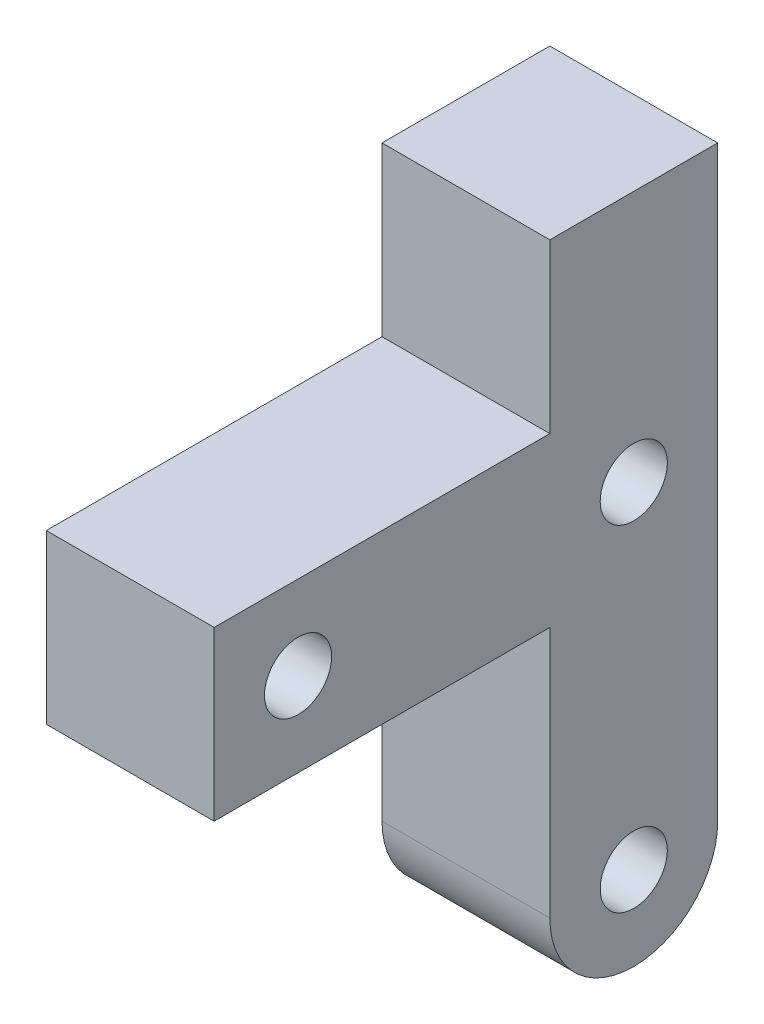
from build123d import *

# Parameters (mm, degrees)
SKETCH1_W           = 10
SKETCH1_H           = 40
BOSS_EXTRUDE1_DEPTH = 10
CUT_EXTRUDE1_REACH  = 44.426
SKETCH2_R           = 2
SKETCH3_W           = 10
SKETCH3_H           = 10
BOSS_EXTRUDE2_DEPTH = 20
CUT_EXTRUDE2_REACH  = 52.99
SKETCH4_R           = 2
SKETCH5_R           = 2
CUT_EXTRUDE3_DEPTH  = 51.990195136
FILLET1_R           = 5


with BuildPart() as part:
    # Sketch1 → Boss-Extrude1 (new body)
    with BuildSketch(Plane.XY):
        with Locations((5, 20)):
            Rectangle(SKETCH1_W, SKETCH1_H)
    extrude(amount=BOSS_EXTRUDE1_DEPTH)

    # Sketch2 → Cut-Extrude1 (cut, up to next)
    with BuildSketch(Plane(origin=(10, 0, 0), x_dir=(0, 0, -1), z_dir=(1, 0, 0)), mode=Mode.PRIVATE) as cut_extrude1_sk1:
        with Locations((-5, 5)):
            Circle(SKETCH2_R)
    cut_extrude1_tool1 = extrude(cut_extrude1_sk1.sketch, amount=-CUT_EXTRUDE1_REACH, mode=Mode.PRIVATE) & part.part
    add(cut_extrude1_tool1.solids().sort_by_distance((10, 5, 5))[0], mode=Mode.SUBTRACT)

    # Sketch3 → Boss-Extrude2 (add)
    with BuildSketch(Plane.XY.offset(10)):
        with Locations((5, 25)):
            Rectangle(SKETCH3_W, SKETCH3_H)
    extrude(amount=BOSS_EXTRUDE2_DEPTH)

    # Sketch4 → Cut-Extrude2 (cut, up to next)
    with BuildSketch(Plane.ZY, mode=Mode.PRIVATE) as cut_extrude2_sk1:
        with Locations((25, 25)):
            Circle(SKETCH4_R)
    cut_extrude2_tool1 = extrude(cut_extrude2_sk1.sketch, amount=-CUT_EXTRUDE2_REACH, mode=Mode.PRIVATE) & part.part
    add(cut_extrude2_tool1.solids().sort_by_distance((0, 25, 25))[0], mode=Mode.SUBTRACT)

    # Sketch5 → Cut-Extrude3 (cut, through all)
    with BuildSketch(Plane.ZY):
        with Locations((5, 25)):
            Circle(SKETCH5_R)
    extrude(amount=-CUT_EXTRUDE3_DEPTH, mode=Mode.SUBTRACT)

    # Fillet1
    fillet1_edges = [part.edges().sort_by_distance(p)[0] for p in [
        (5, 0, 0),
        (5, 0, 10),
    ]]
    fillet(fillet1_edges, radius=FILLET1_R - 0.0001)  # a hair under: the kernel refuses the full size


solid = part.part
